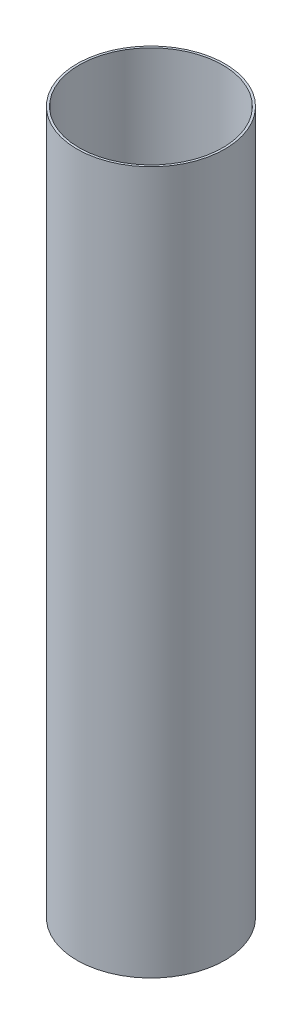
from build123d import *

# Parameters (mm, degrees)
SKETCH1_R           = 51.054
SKETCH1_R_2         = 49.53
BOSS_EXTRUDE1_DEPTH = 485


with BuildPart() as part:
    # Sketch1 → Boss-Extrude1 (new body)
    with BuildSketch(Plane(origin=(0, 150, 0), x_dir=(1, 0, 0), z_dir=(0, 1, 0))):
        Circle(SKETCH1_R)
        Circle(SKETCH1_R_2, mode=Mode.SUBTRACT)
    extrude(amount=BOSS_EXTRUDE1_DEPTH)


solid = part.part
